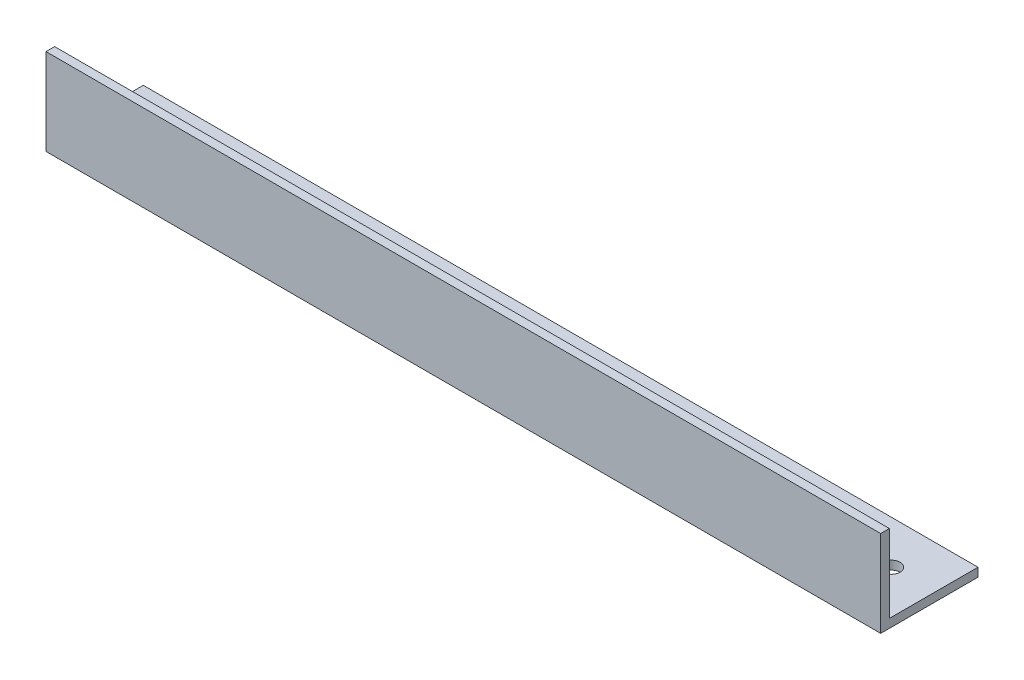
from build123d import *

# Parameters (mm, degrees)
THICKEN1_OUTLINE_W   = 193
THICKEN1_OUTLINE_H   = 22.5
THICKEN1_OUTLINE_R   = 2
THICKEN1_DEPTH       = 2
THICKEN1_START       = 2
THICKEN1_2_OUTLINE_W = 193
THICKEN1_2_OUTLINE_H = 2
THICKEN1_2_DEPTH     = 18


# Read off the part's stored shape, not the designer's step: Thicken1
with BuildPart() as part:
    # Thicken1 outline → Thicken1 (new body)
    with BuildSketch(Plane(origin=(0, 0, 0), x_dir=(1, 0, 0), z_dir=(0, 1, 0))):
        with Locations((96.5, 11.25)):
            Rectangle(THICKEN1_OUTLINE_W, THICKEN1_OUTLINE_H)
        with Locations((10, 12.5)):
            Circle(THICKEN1_OUTLINE_R, mode=Mode.SUBTRACT)
        with Locations((183, 12.5)):
            Circle(THICKEN1_OUTLINE_R, mode=Mode.SUBTRACT)
    extrude(amount=THICKEN1_DEPTH)

    # Thicken1 2 outline → Thicken1 2 (add)
    with BuildSketch(Plane(origin=(0, 0, 0), x_dir=(1, 0, 0), z_dir=(0, 1, 0)).offset(THICKEN1_START)):
        with Locations((96.5, 1)):
            Rectangle(THICKEN1_2_OUTLINE_W, THICKEN1_2_OUTLINE_H)
    extrude(amount=THICKEN1_2_DEPTH)


solid = part.part
